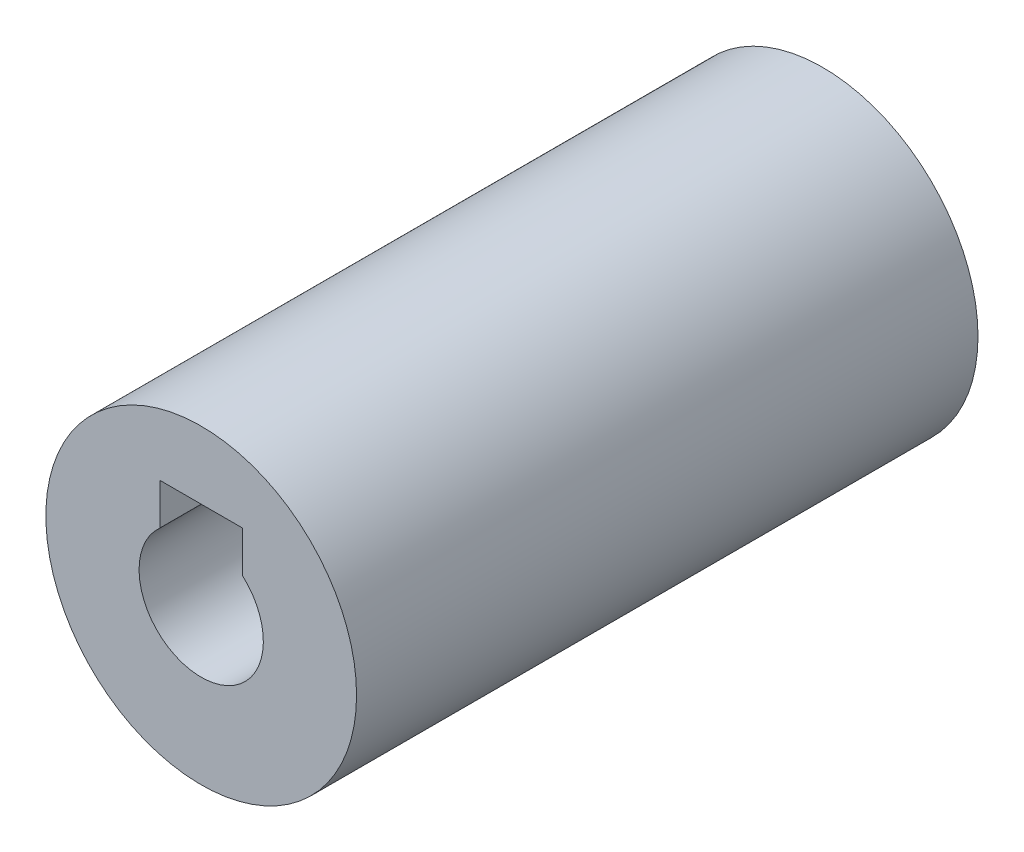
from build123d import *

# Parameters (mm, degrees)
SKETCH1_R           = 7.5
SKETCH1_R_2         = 3
BOSS_EXTRUDE1_DEPTH = 30
CUT_EXTRUDE1_DEPTH  = 32.819805153


with BuildPart() as part:
    # Sketch1 → Boss-Extrude1 (new body)
    with BuildSketch(Plane.XY):
        Circle(SKETCH1_R)
        Circle(SKETCH1_R_2, mode=Mode.SUBTRACT)
    extrude(amount=BOSS_EXTRUDE1_DEPTH)

    # Sketch2 → Cut-Extrude1 (cut, through all)
    with BuildSketch(Plane.XY.offset(30)):
        with BuildLine():
            ThreePointArc((-2, 2.236067977), (0, 3), (2, 2.236067977))
            Line((2, 2.236067977), (2, 4.236067977))
            Line((2, 4.236067977), (-2, 4.236067977))
            Line((-2, 4.236067977), (-2, 2.236067977))
        make_face()
    extrude(amount=-CUT_EXTRUDE1_DEPTH, mode=Mode.SUBTRACT)


solid = part.part
